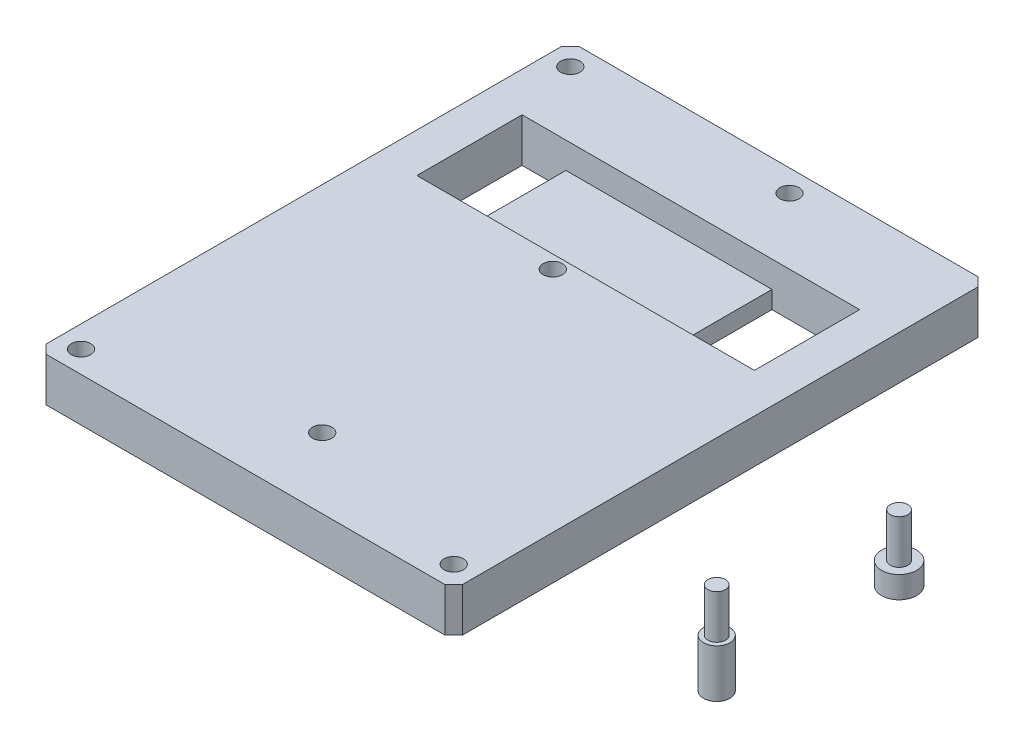
from build123d import *

# Parameters (mm, degrees)
SKETCH_1_W          = 47.5
SKETCH_1_H          = 60.8
EXTRUDE_1_DEPTH     = 5
SKETCH_2_W          = 38.5
SKETCH_2_H          = 12
CUT_EXTRUDE_1_DEPTH = 3
SKETCH_3_W          = 5
SKETCH_3_H          = 12
SKETCH_3_W_2        = 10
CUT_EXTRUDE_2_DEPTH = 2
SKETCH_4_R          = 1.1
CUT_EXTRUDE_3_DEPTH = 5
SKETCH_5_R          = 2
EXTRUDE_2_DEPTH     = 2.5
SKETCH_5_3_R        = 1.5
EXTRUDE_3_DEPTH     = 5.5
SKETCH_6_R          = 1.1
CUT_EXTRUDE_4_DEPTH = 5
SKETCH_7_R          = 1
EXTRUDE_4_DEPTH     = 5
SKETCH_8_R          = 1
EXTRUDE_5_DEPTH     = 5
SKETCH_9_R          = 1.1
CUT_EXTRUDE_5_DEPTH = 5
CHAMFER_1_SIZE      = 1


with BuildPart() as part:
    # 草图1 → 凸台-拉伸1 (new body)
    with BuildSketch(Plane(origin=(0, 0, 0), x_dir=(1, 0, 0), z_dir=(0, 1, 0))):
        with Locations((-30.655286344, 2.938237127)):
            Rectangle(SKETCH_1_W, SKETCH_1_H)
    extrude(amount=-EXTRUDE_1_DEPTH)

    # 草图2 → 切除-拉伸1 (cut)
    with BuildSketch(Plane(origin=(0, 0, 0), x_dir=(1, 0, 0), z_dir=(0, 1, 0))):
        with Locations((-30.655286344, 17.338237127)):
            Rectangle(SKETCH_2_W, SKETCH_2_H)
    extrude(amount=-CUT_EXTRUDE_1_DEPTH, mode=Mode.SUBTRACT)

    # 草图3 → 切除-拉伸2 (cut)
    with BuildSketch(Plane(origin=(0, -3, 0), x_dir=(1, 0, 0), z_dir=(0, 1, 0))):
        with Locations((-47.405286344, 17.338237127)):
            Rectangle(SKETCH_3_W, SKETCH_3_H)
        with Locations((-16.405286344, 17.338237127)):
            Rectangle(SKETCH_3_W_2, SKETCH_3_H)
    extrude(amount=-CUT_EXTRUDE_2_DEPTH, mode=Mode.SUBTRACT)

    # 草图4 → 切除-拉伸3 (cut)
    with BuildSketch(Plane(origin=(0, 0, 0), x_dir=(1, 0, 0), z_dir=(0, 1, 0))):
        with Locations((-9.405286344, -24.961762873)):
            Circle(SKETCH_4_R)
        with Locations((-51.905286344, -24.961762873)):
            Circle(SKETCH_4_R)
        with Locations((-51.905286344, 30.838237127)):
            Circle(SKETCH_4_R)
        with Locations((-26.905286344, 30.838237127)):
            Circle(SKETCH_4_R)
    extrude(amount=-CUT_EXTRUDE_3_DEPTH, mode=Mode.SUBTRACT)

    # 草图6 → 切除-拉伸4 (cut)
    with BuildSketch(Plane(origin=(0, 0, 0), x_dir=(1, 0, 0), z_dir=(0, 1, 0))):
        with Locations((-32.905286344, 9.838237127)):
            Circle(SKETCH_6_R)
    extrude(amount=-CUT_EXTRUDE_4_DEPTH, mode=Mode.SUBTRACT)

    # 草图9 → 切除-拉伸5 (cut)
    with BuildSketch(Plane(origin=(0, 0, 0), x_dir=(1, 0, 0), z_dir=(0, 1, 0))):
        with Locations((-29.905286344, -19.461762873)):
            Circle(SKETCH_9_R)
    extrude(amount=-CUT_EXTRUDE_5_DEPTH, mode=Mode.SUBTRACT)

    # 倒角1
    chamfer_1_edges = [part.edges().sort_by_distance(p)[0] for p in [
        (-54.405286344, -2.5, 27.461762873),
        (-54.405286344, -2.5, -33.338237127),
        (-6.905286344, -2.5, -33.338237127),
        (-6.905286344, -2.5, 27.461762873),
    ]]
    chamfer(chamfer_1_edges, length=CHAMFER_1_SIZE)


with BuildPart() as body_2:
    # 草图5 → 凸台-拉伸2 (new body)
    with BuildSketch(Plane.XZ.offset(5)):
        with Locations((13.094713656, -3.338237127)):
            Circle(SKETCH_5_R)
    extrude(amount=-EXTRUDE_2_DEPTH)

    # 草图7 → 凸台-拉伸4 (add)
    with BuildSketch(Plane(origin=(0, -2.5, 0), x_dir=(1, 0, 0), z_dir=(0, 1, 0))):
        with Locations((13.094713656, 3.338237127)):
            Circle(SKETCH_7_R)
    extrude(amount=EXTRUDE_4_DEPTH)


with BuildPart() as body_3:
    # 草图5<3> → 凸台-拉伸3 (new body)
    with BuildSketch(Plane.XZ.offset(5)):
        with Locations((13.094713656, 17.461762873)):
            Circle(SKETCH_5_3_R)
    extrude(amount=-EXTRUDE_3_DEPTH)

    # 草图8 → 凸台-拉伸5 (add)
    with BuildSketch(Plane(origin=(0, 0.5, 0), x_dir=(1, 0, 0), z_dir=(0, 1, 0))):
        with Locations((13.094713656, -17.461762873)):
            Circle(SKETCH_8_R)
    extrude(amount=EXTRUDE_5_DEPTH)


solid = Compound([part.part, body_2.part, body_3.part])
